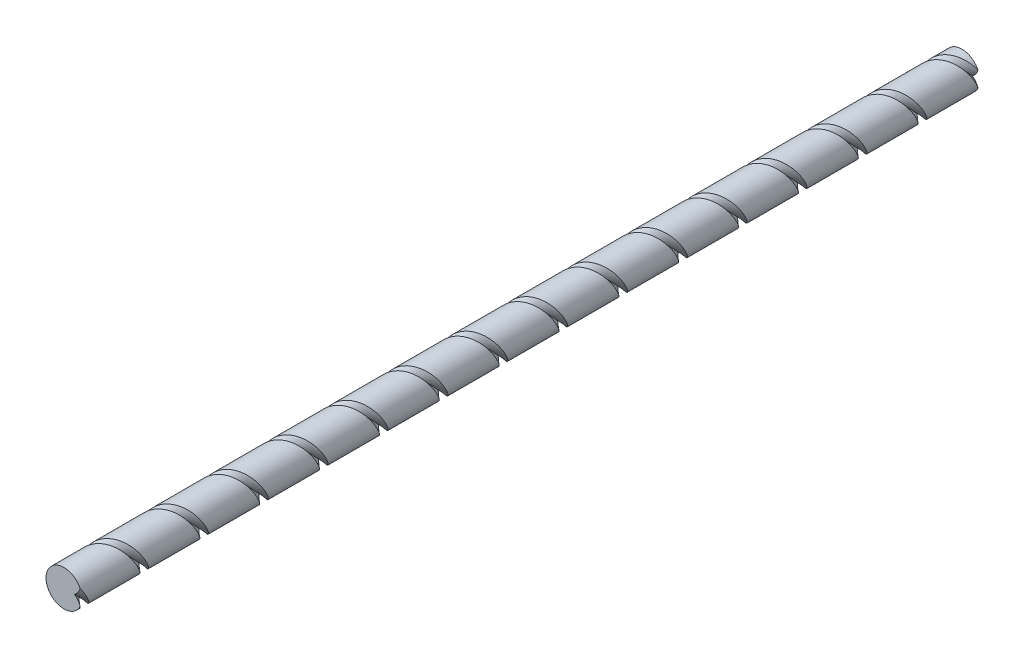
from build123d import *

# Parameters (mm, degrees)
CROQUIS1_R              = 6
SALIENTE_EXTRUIR1_DEPTH = 300
CORTAR_BARRER2_PITCH    = 20


with BuildPart() as part:
    # Croquis1 → Saliente-Extruir1 (new body)
    with BuildSketch(Plane.XY):
        Circle(CROQUIS1_R)
    extrude(amount=SALIENTE_EXTRUIR1_DEPTH)

    # Cortar-Barrer2: arcs per turn and ends read off the stored shape
    # Cortar-Barrer2: the profile of Croquis4 screwed along a right-hand helix through 61 turns, 12 arcs to a turn; built about Z, then put on its axis
    cortar_barrer2_z = Axis((0, 0, 0), (0, 0, 1))
    cortar_barrer2_corners = [(6, 0, -20), (6, 0, -18.556624327), (3.5, 0, -20), (6, 0, -21.443375673)]
    with BuildLine(mode=Mode.PRIVATE) as cortar_barrer2_profile:
        Line(cortar_barrer2_corners[0], cortar_barrer2_corners[1])
        Line(cortar_barrer2_corners[1], cortar_barrer2_corners[2])
        Line(cortar_barrer2_corners[2], cortar_barrer2_corners[3])
        Line(cortar_barrer2_corners[3], cortar_barrer2_corners[0])
    cortar_barrer2_cap = Face(cortar_barrer2_profile.wire())
    cortar_barrer2_turn_angles = [0, 15, 30, 45, 60, 75, 90, 105, 120, 135, 150, 165, 180, 195, 210, 225, 240, 255, 270, 285, 300, 315, 330, 345, 360]
    cortar_barrer2_turn_weights = [1, 0.9659258262890683, 1, 0.9659258262890683, 1, 0.9659258262890683, 1, 0.9659258262890683, 1, 0.9659258262890683, 1, 0.9659258262890683, 1, 0.9659258262890683, 1, 0.9659258262890683, 1, 0.9659258262890683, 1, 0.9659258262890683, 1, 0.9659258262890683, 1, 0.9659258262890683, 1]
    cortar_barrer2_turn_rails = [Edge.make_bspline([Vector(p[0], p[1], 0).rotate(cortar_barrer2_z, cortar_barrer2_turn_angles[k]) / cortar_barrer2_turn_weights[k] + Vector(0, 0, p[2] + CORTAR_BARRER2_PITCH * cortar_barrer2_turn_angles[k] / 360) for k in range(25)], [0, 0, 0, 1, 1, 2, 2, 3, 3, 4, 4, 5, 5, 6, 6, 7, 7, 8, 8, 9, 9, 10, 10, 11, 11, 12, 12, 12], 2, cortar_barrer2_turn_weights) for p in cortar_barrer2_corners]
    cortar_barrer2_turn_sides = [Face.make_surface_from_curves(cortar_barrer2_turn_rails[p[0]], cortar_barrer2_turn_rails[p[1]]) for p in [(0, 1), (1, 2), (2, 3), (3, 0)]]
    cortar_barrer2 = Plane(origin=(0, 0, 300), x_dir=(1, 0, 0), z_dir=(0, 0, -1)) * Solid(Shell([*[p.moved(Location((0, 0, CORTAR_BARRER2_PITCH * i))) for i in range(61) for p in cortar_barrer2_turn_sides], cortar_barrer2_cap, cortar_barrer2_cap.rotate(cortar_barrer2_z, 21960).moved(Location((0, 0, CORTAR_BARRER2_PITCH * 21960 / 360)))]))
    add(cortar_barrer2, mode=Mode.SUBTRACT)


solid = part.part
